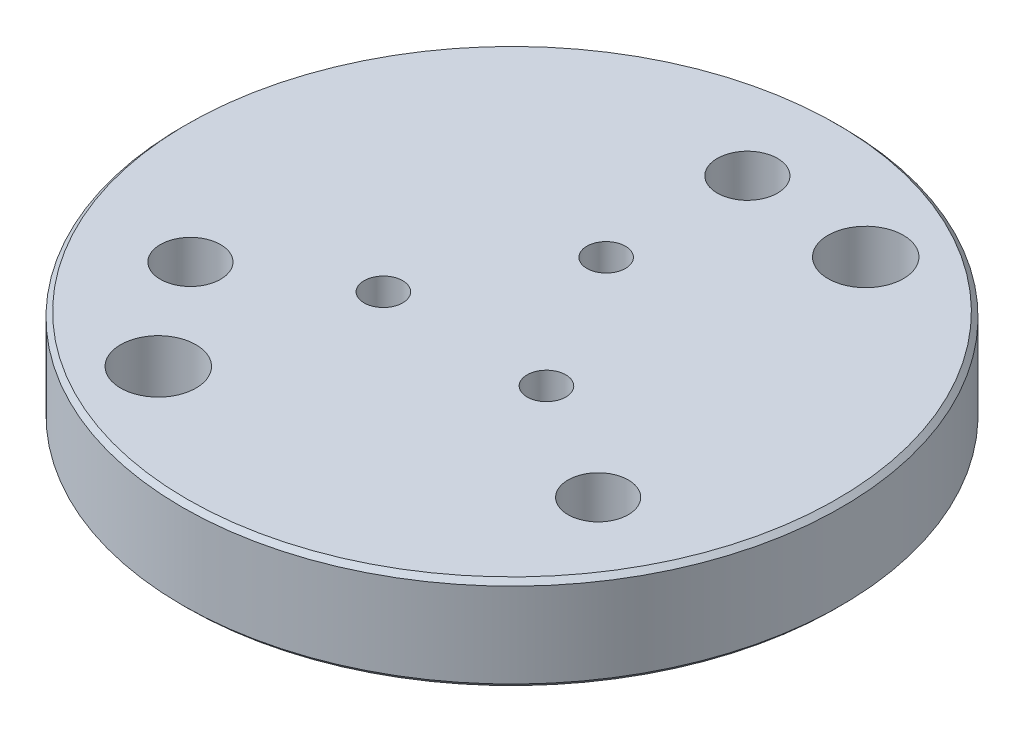
from build123d import *

# Parameters (mm, degrees)
SKETCH1_R             = 35
BOSS_EXTRUDE1_DEPTH   = 10
CUT_EXTRUDE1_REACH    = 52.498
SKETCH2_R             = 2.05
F_8_0MM_DOWEL_HOLE1_D = 8
M6_CLEARANCE_HOLE1_D  = 6.4
CHAMFER1_SIZE         = 0.5


with BuildPart() as part:
    # Sketch1 → Boss-Extrude1 (new body)
    with BuildSketch(Plane(origin=(0, 0, 0), x_dir=(1, 0, 0), z_dir=(0, 1, 0))):
        Circle(SKETCH1_R)
    extrude(amount=-BOSS_EXTRUDE1_DEPTH)

    # Sketch2 → Cut-Extrude1 (cut, up to next)
    with BuildSketch(Plane(origin=(0, 0, 0), x_dir=(1, 0, 0), z_dir=(0, 1, 0)), mode=Mode.PRIVATE) as cut_extrude1_sk1:
        with Locations((8.660254038, -5)):
            Circle(SKETCH2_R)
    cut_extrude1_tool1 = extrude(cut_extrude1_sk1.sketch, amount=-CUT_EXTRUDE1_REACH, mode=Mode.PRIVATE) & part.part
    # Sketch2 → Cut-Extrude1 (cut, up to next)
    with BuildSketch(Plane(origin=(0, 0, 0), x_dir=(1, 0, 0), z_dir=(0, 1, 0)), mode=Mode.PRIVATE) as cut_extrude1_sk2:
        with Locations((0, 10)):
            Circle(SKETCH2_R)
    cut_extrude1_tool2 = extrude(cut_extrude1_sk2.sketch, amount=-CUT_EXTRUDE1_REACH, mode=Mode.PRIVATE) & part.part
    # Sketch2 → Cut-Extrude1 (cut, up to next)
    with BuildSketch(Plane(origin=(0, 0, 0), x_dir=(1, 0, 0), z_dir=(0, 1, 0)), mode=Mode.PRIVATE) as cut_extrude1_sk3:
        with Locations((-8.660254038, -5)):
            Circle(SKETCH2_R)
    cut_extrude1_tool3 = extrude(cut_extrude1_sk3.sketch, amount=-CUT_EXTRUDE1_REACH, mode=Mode.PRIVATE) & part.part
    add(cut_extrude1_tool1.solids().sort_by_distance((8.660254, 0, 5))[0], mode=Mode.SUBTRACT)
    add(cut_extrude1_tool2.solids().sort_by_distance((0, 0, -10))[0], mode=Mode.SUBTRACT)
    add(cut_extrude1_tool3.solids().sort_by_distance((-8.660254, 0, 5))[0], mode=Mode.SUBTRACT)

    # Ø8.0mm Dowel Hole1 (through all)
    with Locations(Plane(origin=(0, -10, 0), x_dir=(-1, 0, 0), z_dir=(0, -1, 0))):
        with Locations((-13.75, 23.815698604), (13.75, -23.815698604)):
            Hole(F_8_0MM_DOWEL_HOLE1_D / 2)

    # M6 Clearance Hole1 (through all)
    with Locations(Plane(origin=(0, -10, 0), x_dir=(-1, 0, 0), z_dir=(0, -1, 0))):
        with Locations((-21.650635095, -12.5), (21.650635095, -12.5), (0, 25)):
            Hole(M6_CLEARANCE_HOLE1_D / 2)

    # Chamfer1
    chamfer1_edges = [part.edges().sort_by_distance(p)[0] for p in [
        (-35, 0, 0),
        (-35, -10, 0),
    ]]
    chamfer(chamfer1_edges, length=CHAMFER1_SIZE)


solid = part.part
